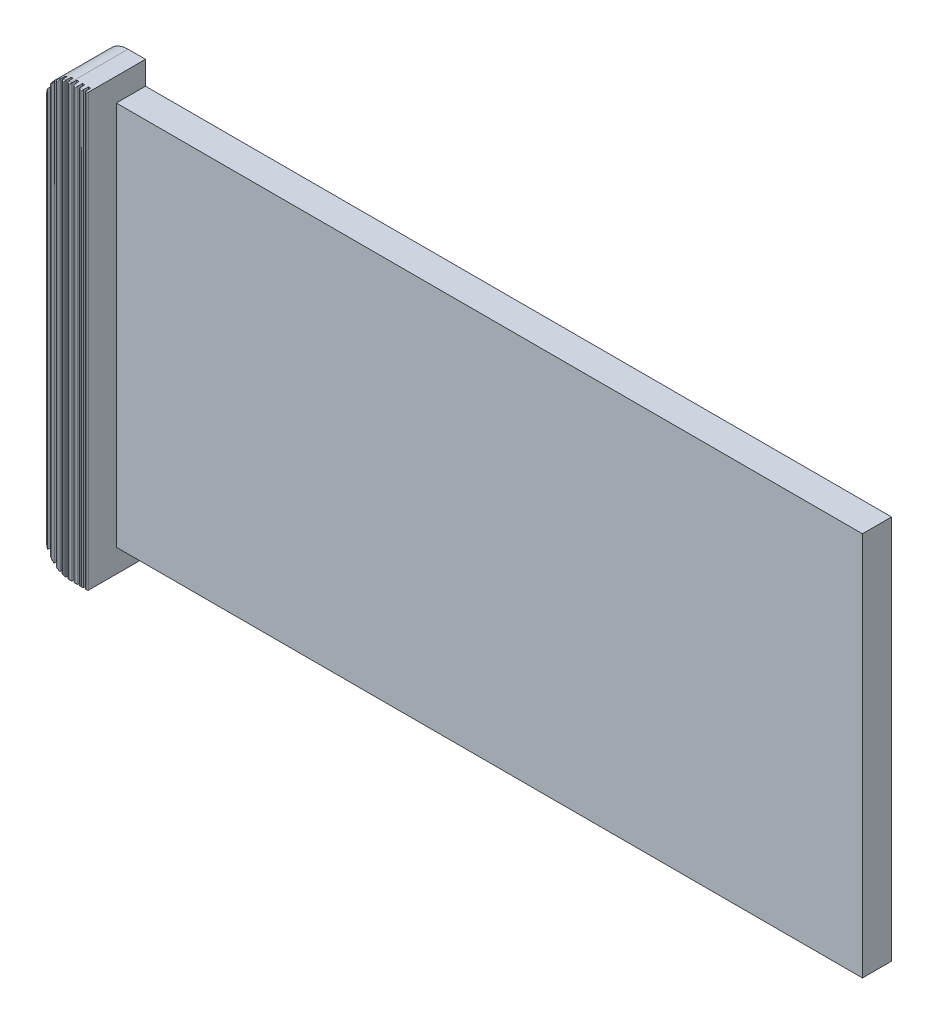
from build123d import *

# Parameters (mm, degrees)
CROQUIS1_W              = 64
CROQUIS1_H              = 33
SALIENTE_EXTRUIR1_DEPTH = 2.5
CROQUIS3_W              = 5
CROQUIS3_H              = 37
SALIENTE_EXTRUIR2_DEPTH = 3.5
REDONDEO1_R             = 2
CROQUIS4_W              = 0.2
CROQUIS4_H              = 37
CORTAR_EXTRUIR1_DEPTH   = 0.5
REDONDEO2_R             = 0.1


with BuildPart() as part:
    # Croquis1 → Saliente-Extruir1 (new body)
    with BuildSketch(Plane.XY):
        Rectangle(CROQUIS1_W, CROQUIS1_H)
    extrude(amount=SALIENTE_EXTRUIR1_DEPTH)

    # Croquis3 → Saliente-Extruir2 (add)
    with BuildSketch(Plane.ZY.offset(32)):
        with Locations((2.5, 0)):
            Rectangle(CROQUIS3_W, CROQUIS3_H)
    extrude(amount=SALIENTE_EXTRUIR2_DEPTH)

    # Redondeo1
    redondeo1_edges = [part.edges().sort_by_distance(p)[0] for p in [
        (-35.5, 18.5, 2.5),
        (-35.5, -18.5, 2.5),
    ]]
    fillet(redondeo1_edges, radius=REDONDEO1_R)

    # Croquis4 → Cortar-Extruir1 (cut)
    with BuildSketch(Plane.XY.offset(5)):
        with Locations((-32.3, 0)):
            Rectangle(CROQUIS4_W, CROQUIS4_H)
        with Locations((-32.8, 0)):
            Rectangle(CROQUIS4_W, CROQUIS4_H)
        with Locations((-33.3, 0)):
            Rectangle(CROQUIS4_W, CROQUIS4_H)
        with Locations((-33.8, 0)):
            Rectangle(CROQUIS4_W, CROQUIS4_H)
        with Locations((-34.3, 0)):
            Rectangle(CROQUIS4_W, CROQUIS4_H)
        with Locations((-34.8, 0)):
            Rectangle(CROQUIS4_W, CROQUIS4_H)
        with Locations((-35.3, 0)):
            Rectangle(CROQUIS4_W, CROQUIS4_H)
    extrude(amount=-CORTAR_EXTRUIR1_DEPTH, mode=Mode.SUBTRACT)

    # Redondeo2
    redondeo2_edges = [part.edges().sort_by_distance(p)[0] for p in [
        (-34.2, 0, 5),
        (-34.4, 0, 5),
        (-34.7, 0, 5),
        (-34.9, 0, 5),
        (-35.2, 0, 5),
        (-32, 0, 5),
        (-33.45, 18.5, 5),
        (-33.45, -18.5, 5),
        (-33.60012555, 18.497492146, 5),
        (-34.051681951, 18.422406571, 5),
        (-34.554113045, 18.199660463, 5),
        (-35.061282751, 17.749958468, 5),
        (-35.061282751, -17.749958468, 5),
        (-34.554113045, -18.199660463, 5),
        (-34.051681951, -18.422406571, 5),
        (-33.60012555, -18.497492146, 5),
        (-33.05, -18.5, 5),
        (-32.55, -18.5, 5),
        (-32.1, -18.5, 5),
        (-33.05, 18.5, 5),
        (-32.55, 18.5, 5),
        (-32.1, 18.5, 5),
        (-32.4, 0, 5),
        (-32.2, 0, 5),
        (-32.9, 0, 5),
        (-32.7, 0, 5),
        (-33.4, 0, 5),
        (-33.2, 0, 5),
        (-33.7, 0, 5),
        (-33.9, 0, 5),
    ]]
    fillet(redondeo2_edges, radius=REDONDEO2_R - 0.0001)  # a hair under: the kernel refuses the full size


solid = part.part
